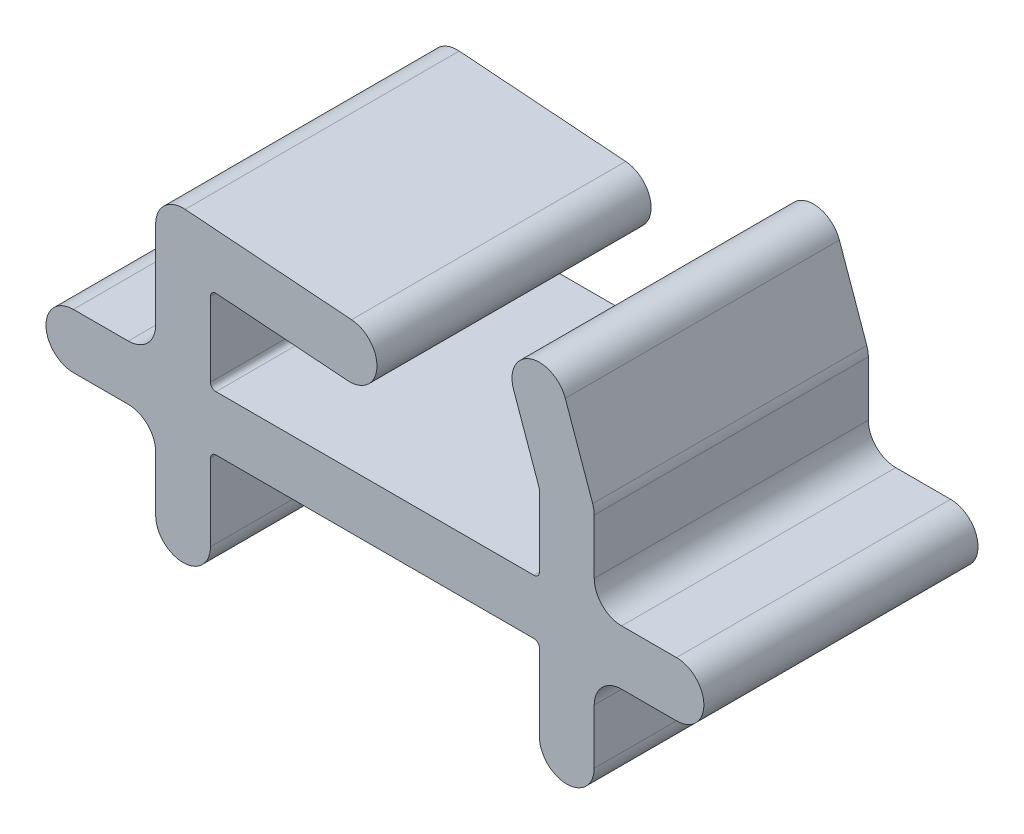
from build123d import *

# Parameters (mm, degrees)
BOSS_EXTRUDE1_DEPTH = 5
BOSS_EXTRUDE2_DEPTH = 5
FILLET2_R           = 1
FILLET3_R           = 0.2
MIRROR2_START       = -5
MIRROR2_DEPTH       = 10
BOSS_EXTRUDE3_DEPTH = 5
FILLET4_R           = 0.2


# Read off the part's stored shape, not the designer's step: Mirror2
with BuildPart() as part:
    # Sketch1 → Boss-Extrude1 (new, symmetric)
    with BuildSketch(Plane.XY):
        with BuildLine():
            Line((-6, -1), (0, -1))
            Line((0, -1), (0, 1))
            Line((0, 1), (-6, 1))
            Line((-6, 1), (-8, 1))
            Line((-8, 1), (-8, -4))
            ThreePointArc((-8, -4), (-7, -5), (-6, -4))
            Line((-6, -4), (-6, -1))
        make_face()
    extrude(amount=BOSS_EXTRUDE1_DEPTH, both=True)

    # Sketch2 → Boss-Extrude2 (add, symmetric)
    with BuildSketch(Plane.XY):
        with BuildLine():
            Line((-8, -1), (-11, -1))
            ThreePointArc((-11, -1), (-12, 0), (-11, 1))
            Line((-11, 1), (-8, 1))
            ThreePointArc((-8, 1), (-7, 0), (-8, -1))
        make_face()
    extrude(amount=BOSS_EXTRUDE2_DEPTH, both=True)

    # Fillet2
    fillet2_edges = [part.edges().sort_by_distance(p)[0] for p in [
        (-8, -1, 0),
    ]]
    fillet(fillet2_edges, radius=FILLET2_R)

    # Fillet3
    fillet3_edges = [part.edges().sort_by_distance(p)[0] for p in [
        (-6, -1, 0),
    ]]
    fillet(fillet3_edges, radius=FILLET3_R)

    # Mirror2 outline → Mirror2 (add)
    with BuildSketch(Plane.XY.offset(MIRROR2_START)):
        with BuildLine():
            Line((5.8, 1), (0, 1))
            Line((0, 1), (0, -1))
            Line((0, -1), (5.8, -1))
            ThreePointArc((5.8, -1), (5.941421356, -1.058578644), (6, -1.2))
            Line((6, -1.2), (6, -4))
            ThreePointArc((6, -4), (7, -5), (8, -4))
            Line((8, -4), (8, -2))
            ThreePointArc((8, -2), (8.292893219, -1.292893219), (9, -1))
            Line((9, -1), (11, -1))
            ThreePointArc((11, -1), (12, 0), (11, 1))
            Line((11, 1), (9, 1))
            ThreePointArc((9, 1), (8.292893219, 1.292893219), (8, 2))
            Line((8, 2), (8, 4))
            ThreePointArc((8, 4), (7, 5), (6, 4))
            Line((6, 4), (6, 1.2))
            ThreePointArc((6, 1.2), (5.941421356, 1.058578644), (5.8, 1))
        make_face()
        with BuildLine():
            Line((-9, 1), (-5.8, 1))
            ThreePointArc((-5.8, 1), (-5.941421356, 1.058578644), (-6, 1.2))
            Line((-6, 1.2), (-6, 4))
            ThreePointArc((-6, 4), (-7, 5), (-8, 4))
            Line((-8, 4), (-8, 2))
            ThreePointArc((-8, 2), (-8.292893219, 1.292893219), (-9, 1))
        make_face()
    extrude(amount=MIRROR2_DEPTH)

    # Sketch4 → Boss-Extrude3 (add, symmetric)
    with BuildSketch(Plane.XY):
        with BuildLine():
            Line((-6.92611483, 6.197266755), (-0.852229659, 5.747266755))
            ThreePointArc((-0.852229659, 5.747266755), (0.071151926, 4.67611483), (-1, 3.752733245))
            Line((-1, 3.752733245), (-7.07388517, 4.202733245))
            ThreePointArc((-7.07388517, 4.202733245), (-7.997266755, 5.27388517), (-6.92611483, 6.197266755))
        make_face()
        with BuildLine():
            Line((6.057190958, 3.666666667), (5.057190958, 6.495093791))
            ThreePointArc((5.057190958, 6.495093791), (5.666666667, 7.771236166), (6.942809042, 7.161760458))
            Line((6.942809042, 7.161760458), (7.942809042, 4.333333333))
            ThreePointArc((7.942809042, 4.333333333), (7.333333333, 3.057190958), (6.057190958, 3.666666667))
        make_face()
        with BuildLine():
            Line((-6, 5.2), (-6, 4))
            ThreePointArc((-6, 4), (-7, 3), (-8, 4))
            Line((-8, 4), (-8, 5.2))
            ThreePointArc((-8, 5.2), (-7, 6.2), (-6, 5.2))
        make_face()
    extrude(amount=BOSS_EXTRUDE3_DEPTH, both=True)

    # Fillet4
    fillet4_edges = [part.edges().sort_by_distance(p)[0] for p in [
        (-6, 4.123171594, 0),
    ]]
    fillet(fillet4_edges, radius=FILLET4_R)


solid = part.part
